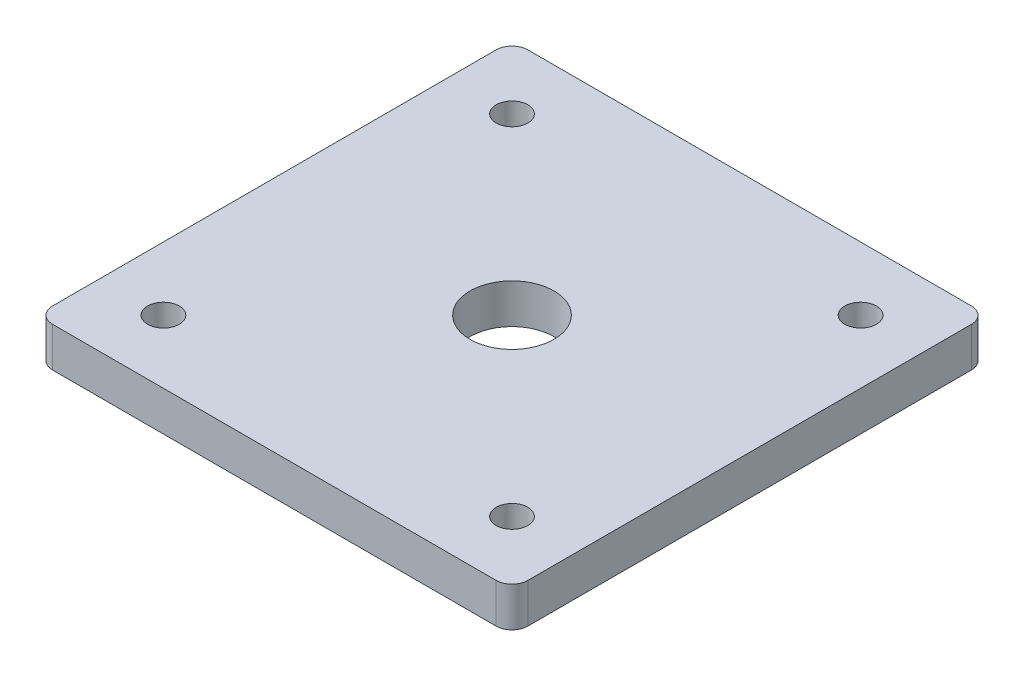
from build123d import *

# Parameters (mm, degrees)
SKETCH2_W           = 38.1
SKETCH2_H           = 38.1
SKETCH2_R           = 1.27
SKETCH2_R_2         = 3.3655
BOSS_EXTRUDE1_DEPTH = 3.175
FILLET1_R           = 1.27


with BuildPart() as part:
    # Sketch2 → Boss-Extrude1 (new body)
    with BuildSketch(Plane(origin=(0, 0, 0), x_dir=(1, 0, 0), z_dir=(0, 1, 0))):
        Rectangle(SKETCH2_W, SKETCH2_H)
        with Locations((-13.97, 13.97)):
            Circle(SKETCH2_R, mode=Mode.SUBTRACT)
        with Locations((-13.97, -13.97)):
            Circle(SKETCH2_R, mode=Mode.SUBTRACT)
        with Locations((13.97, -13.97)):
            Circle(SKETCH2_R, mode=Mode.SUBTRACT)
        with Locations((13.97, 13.97)):
            Circle(SKETCH2_R, mode=Mode.SUBTRACT)
        Circle(SKETCH2_R_2, mode=Mode.SUBTRACT)
    extrude(amount=BOSS_EXTRUDE1_DEPTH)

    # Fillet1
    fillet1_edges = [part.edges().sort_by_distance(p)[0] for p in [
        (-19.05, 1.5875, -19.05),
        (19.05, 1.5875, -19.05),
        (19.05, 1.5875, 19.05),
        (-19.05, 1.5875, 19.05),
    ]]
    fillet(fillet1_edges, radius=FILLET1_R)


solid = part.part
